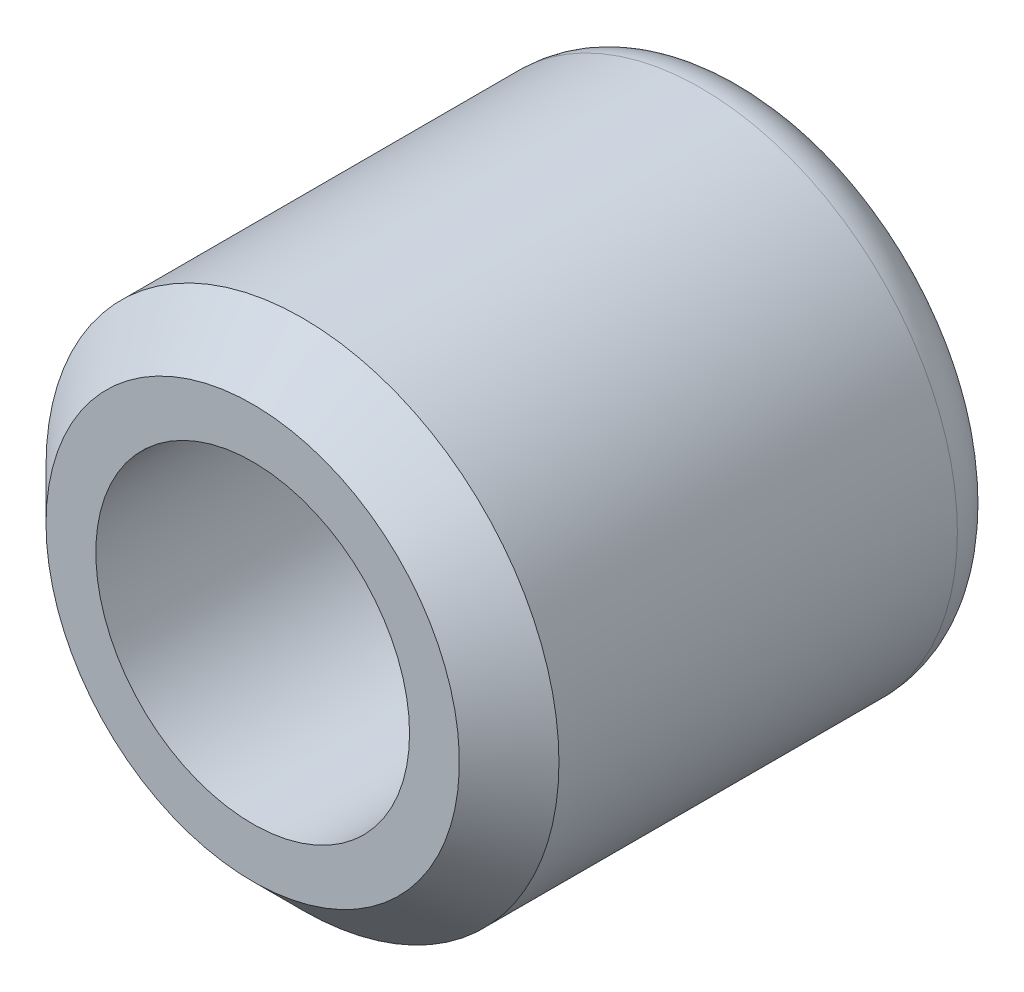
from build123d import *

# Parameters (mm, degrees)
SKETCH1_W     = 2
SKETCH1_H     = 10
CHAMFER1_SIZE = 1
FILLET1_R     = 1


with BuildPart() as part:
    # Sketch1 → Revolve1 (revolve)
    with BuildSketch(Plane(origin=(0, 0, 0), x_dir=(1, 0, 0), z_dir=(0, 1, 0))):
        with Locations((-4.15, 5)):
            Rectangle(SKETCH1_W, SKETCH1_H)
    revolve(axis=Axis((0, 0, 0), (0, 0, -1)))

    # Chamfer1
    chamfer1_edges = [part.edges().sort_by_distance(p)[0] for p in [
        (5.15, 0, 0),
    ]]
    chamfer(chamfer1_edges, length=CHAMFER1_SIZE)

    # Fillet1
    fillet1_edges = [part.edges().sort_by_distance(p)[0] for p in [
        (5.15, 0, -10),
    ]]
    fillet(fillet1_edges, radius=FILLET1_R)


solid = part.part
